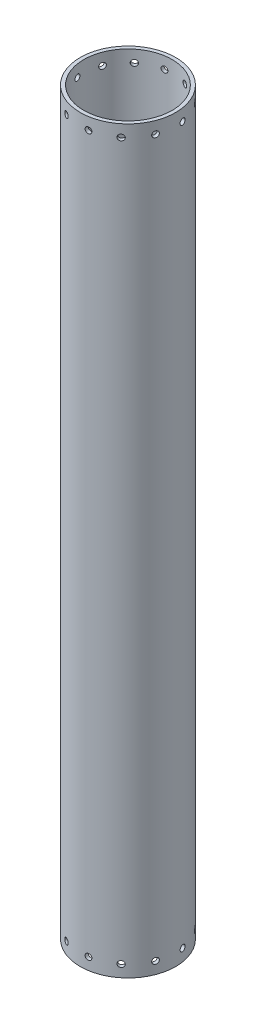
from build123d import *

# Parameters (mm, degrees)
SKETCH1_R                              = 63.5
SKETCH1_R_2                            = 58.7375
BOSS_EXTRUDE1_DEPTH                    = 984.25
F_5_16_START                           = 58.603267125
F_5_16_0_3125_DIAMETER_HOLE1_OUTLINE_R = 3.96875
F_5_16_0_3125_DIAMETER_HOLE1_DEPTH     = 4.896732909
CIRPATTERN1_COUNT                      = 12


# Read off the part's stored shape, not the designer's step: 5/16 (0.3125) Diameter Hole1
with BuildPart() as part:
    # Sketch1 → Boss-Extrude1 (new body)
    with BuildSketch(Plane(origin=(0, 0, 0), x_dir=(1, 0, 0), z_dir=(0, 1, 0))):
        with Locations(Location((0, 0, 0), (0, 0, 270))):
            Circle(SKETCH1_R)
        with Locations(Location((0, 0, 0), (0, 0, 270))):
            Circle(SKETCH1_R_2, mode=Mode.SUBTRACT)
    extrude(amount=BOSS_EXTRUDE1_DEPTH)

    # 5/16 (0.3125) Diameter Hole1 outline → 5/16 (0.3125) Diameter Hole1 (cut)
    with BuildSketch(Plane(origin=(0, 0, 0), x_dir=(0.9344161207543523, 0, 0.3561832579928311), z_dir=(0.3561832579928311, 0, -0.9344161207543523)).offset(F_5_16_START)):
        with Locations((0, -15.875)):
            Circle(F_5_16_0_3125_DIAMETER_HOLE1_OUTLINE_R)
        with Locations((0, -968.375)):
            Circle(F_5_16_0_3125_DIAMETER_HOLE1_OUTLINE_R)
    f_5_16_0_3125_diameter_hole1 = extrude(amount=F_5_16_0_3125_DIAMETER_HOLE1_DEPTH, mode=Mode.SUBTRACT)

    # CirPattern1: 5/16 (0.3125) Diameter Hole1 ×12 about axis
    cirpattern1_axis = Axis((0, 984.25, 0), (0, 1, 0))
    for i in range(1, CIRPATTERN1_COUNT):
        add(f_5_16_0_3125_diameter_hole1.rotate(cirpattern1_axis, i * 360 / CIRPATTERN1_COUNT), mode=Mode.SUBTRACT)


solid = part.part
